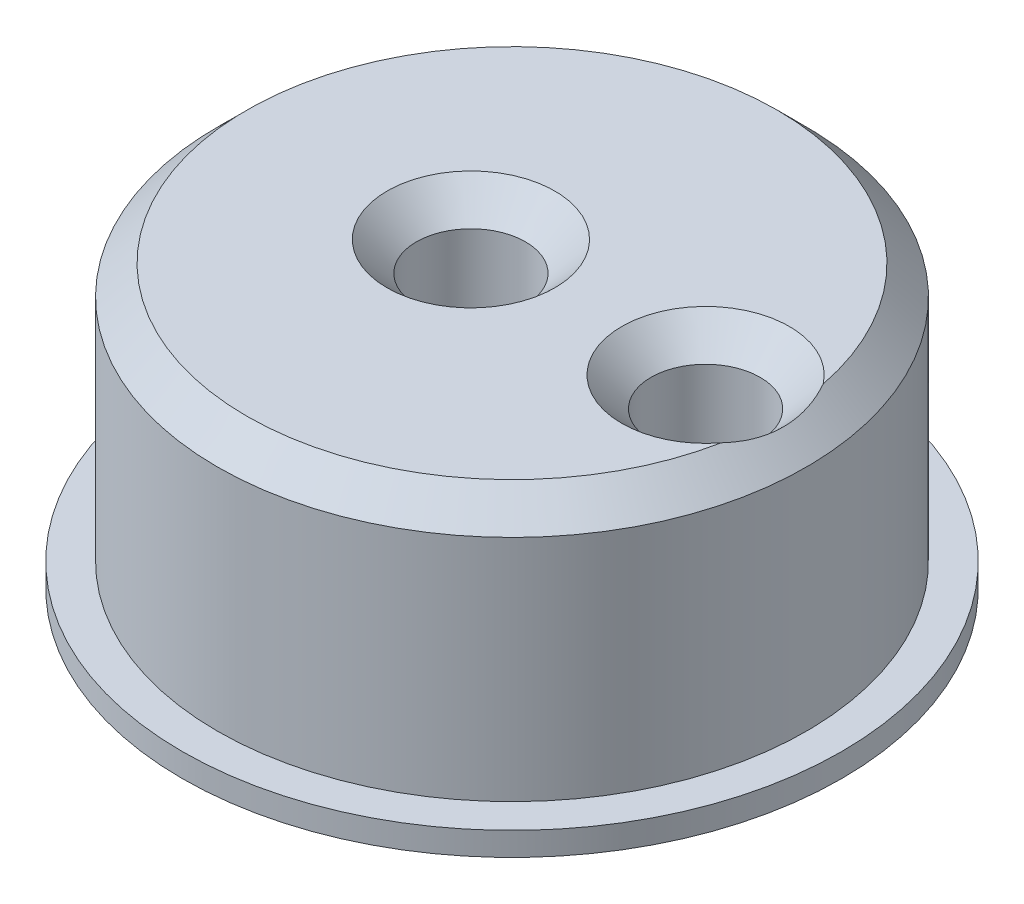
from build123d import *
from build123d.topology import SkipClean

# Parameters (mm, degrees)
SKETCH_1_R      = 5.02
SKETCH_1_R_2    = 0.93
EXTRUDE_1_DEPTH = 4.4
EXTRUDE_START   = 0.4
SKETCH_3_R      = 5.62
SKETCH_3_R_2    = 0.93
EXTRUDE_2_DEPTH = 0.4
CHAMFER_1_SIZE  = 0.5


with BuildPart() as part:
    # 草图1 → 凸台-拉伸1 (new body)
    with BuildSketch(Plane(origin=(0, 0, 0), x_dir=(1, 0, 0), z_dir=(0, 1, 0))):
        with Locations(Location((0, 0, 0), (0, 0, 270))):
            Circle(SKETCH_1_R)
        with Locations(Location((3.3, 0, 0), (0, 0, 270))):
            Circle(SKETCH_1_R_2, mode=Mode.SUBTRACT)
        with Locations(Location((-0.7, 0, 0), (0, 0, 90))):
            Circle(SKETCH_1_R_2, mode=Mode.SUBTRACT)
    extrude(amount=EXTRUDE_1_DEPTH)

    # 草图3 → 凸台-拉伸2 (add)
    with SkipClean():  # the faces are left unmerged after this step: merging them gives an invalid solid
        with BuildSketch(Plane.XZ.offset(EXTRUDE_START)):
            with Locations(Location((0, 0, 0), (0, 0, 270))):
                Circle(SKETCH_3_R)
            with Locations(Location((3.3, 0, 0), (0, 0, 270))):
                Circle(SKETCH_3_R_2, mode=Mode.SUBTRACT)
            with Locations(Location((-0.7, 0, 0), (0, 0, 270))):
                Circle(SKETCH_3_R_2, mode=Mode.SUBTRACT)
        extrude(amount=-EXTRUDE_2_DEPTH)

    # 倒角1
    # the kernel refuses this chamfer: 0.5 mm, written as the material it takes off along each edge
    with BuildSketch(Plane(origin=(3.3, -0.4, 0), x_dir=(0, 0, -1), z_dir=(-1, 0, 0))) as chamfer_1_piece_1:
        Polygon((0.93 + CHAMFER_1_SIZE, 0), (0.93, -CHAMFER_1_SIZE), (0.93, 0), align=None)
    revolve(axis=Axis((3.3, -0.4, 0), (0, -1, 0)), mode=Mode.SUBTRACT)
    with BuildSketch(Plane(origin=(-0.7, -0.4, 0), x_dir=(0, 0, -1), z_dir=(-1, 0, 0))) as chamfer_1_piece_2:
        Polygon((0.93 + CHAMFER_1_SIZE, 0), (0.93, -CHAMFER_1_SIZE), (0.93, 0), align=None)
    revolve(axis=Axis((-0.7, -0.4, 0), (0, -1, 0)), mode=Mode.SUBTRACT)
    with BuildSketch(Plane(origin=(0, 4.4, 0), x_dir=(0, 0, 1), z_dir=(-1, 0, 0))) as chamfer_1_piece_3:
        Polygon((5.02, -CHAMFER_1_SIZE), (5.02 - CHAMFER_1_SIZE, 0), (5.02, 0), align=None)
    revolve(axis=Axis((0, 4.4, 0), (0, 1, 0)), mode=Mode.SUBTRACT)
    with BuildSketch(Plane(origin=(3.3, 4.4, 0), x_dir=(0, 0, 1), z_dir=(-1, 0, 0))) as chamfer_1_piece_4:
        Polygon((0.93 + CHAMFER_1_SIZE, 0), (0.93, -CHAMFER_1_SIZE), (0.93, 0), align=None)
    revolve(axis=Axis((3.3, 4.4, 0), (0, 1, 0)), mode=Mode.SUBTRACT)
    with BuildSketch(Plane(origin=(-0.7, 4.4, 0), x_dir=(0, 0, -1), z_dir=(1, 0, 0))) as chamfer_1_piece_5:
        Polygon((0.93 + CHAMFER_1_SIZE, 0), (0.93, -CHAMFER_1_SIZE), (0.93, 0), align=None)
    revolve(axis=Axis((-0.7, 4.4, 0), (0, 1, 0)), mode=Mode.SUBTRACT)


solid = part.part
